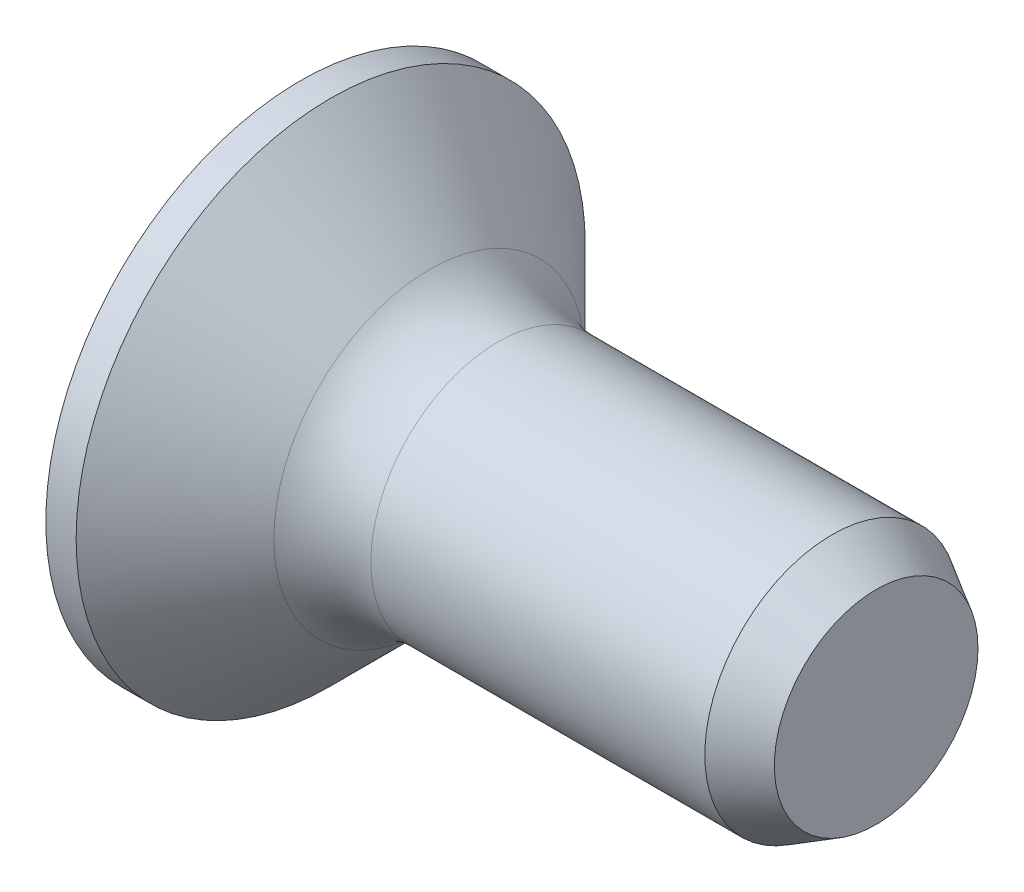
from build123d import *

# Parameters (mm, degrees)
CHAMFER1_SIZE      = 0.42
CHAMFER1_SIZE2     = 0.727461339
CUT_EXTRUDE1_DEPTH = 2.1
DRAFT1_ANGLE       = 35
DRAFT2_ANGLE       = 8
FILLET1_R          = 1.6


with BuildPart() as part:
    # Sketch1 → Revolve1 (revolve)
    with BuildSketch(Plane.XY):
        Polygon((0, 4.2), (0.5, 4.2), (2.6, 2.1), (9.5, 2.1), (9.5, 0), (0, 0), align=None)
    revolve(axis=Axis((6.620684694, 0, 0), (-1, 0, 0)))

    # Chamfer1
    chamfer1_edges = [part.edges().sort_by_distance(p)[0] for p in [
        (9.5, -2.1, 0),
    ]]
    chamfer1_side = [part.faces().sort_by_distance(p)[0] for p in [
        (9.5, 0, 0),
    ]]
    chamfer(chamfer1_edges, length=CHAMFER1_SIZE, length2=CHAMFER1_SIZE2, reference=chamfer1_side[0])

    # Sketch4 → Cut-Extrude1 (cut)
    with BuildSketch(Plane.ZY):
        Polygon((-0.575, 2.3), (-0.575, 0.575), (-2.3, 0.575), (-2.3, -0.575), (-0.575, -0.575), (-0.575, -2.3), (0.575, -2.3), (0.575, -0.575), (2.3, -0.575), (2.3, 0.575), (0.575, 0.575), (0.575, 2.3), align=None)
    extrude(amount=-CUT_EXTRUDE1_DEPTH, mode=Mode.SUBTRACT)

    # Draft1
    draft1_faces = [part.faces().sort_by_distance(p)[0] for p in [
        (1.05, 0, 2.3),
        (1.05, 2.3, 0),
        (1.05, 0, -2.3),
        (1.05, -2.3, 0),
    ]]
    draft(draft1_faces, Plane(origin=(0, 0, 0), x_dir=(0, 0, -1), z_dir=(-1, 0, 0)), DRAFT1_ANGLE)

    # Draft2
    draft2_faces = [part.faces().sort_by_distance(p)[0] for p in [
        (0.790017248, -1.160911984, -0.575),
        (0.790017248, -0.575, -1.160911984),
        (0.790017248, -0.575, 1.160911984),
        (0.790017248, -1.160911984, 0.575),
        (0.790017248, 1.160911984, 0.575),
        (0.790017248, 0.575, 1.160911984),
        (0.790017248, 0.575, -1.160911984),
        (0.790017248, 1.160911984, -0.575),
    ]]
    draft(draft2_faces, Plane(origin=(0, 0, 0), x_dir=(0, 0, -1), z_dir=(-1, 0, 0)), DRAFT2_ANGLE)

    # Sketch6 for Cut-Loft1 → Cut-Loft1 section 0
    with BuildSketch(Plane.ZY.offset(-2.1)):
        with BuildLine():
            Line((-0.554714208, 0.279864247), (-0.554714208, -0.279864247))
            # circular arc as an exact rational Bezier (weights 1, cos(half-angle), 1)
            Bezier((-0.554714208, -0.279864247), (-0.279864247, -0.279864247), (-0.279864247, -0.554714208), weights=[1, 0.707106781, 1])
            Line((-0.279864247, -0.554714208), (0.279864247, -0.554714208))
            Bezier((0.279864247, -0.554714208), (0.279864247, -0.279864247), (0.554714208, -0.279864247), weights=[1, 0.707106781, 1])
            Line((0.554714208, -0.279864247), (0.554714208, 0.279864247))
            Bezier((0.554714208, 0.279864247), (0.279864247, 0.279864247), (0.279864247, 0.554714208), weights=[1, 0.707106781, 1])
            Line((0.279864247, 0.554714208), (-0.279864247, 0.554714208))
            Bezier((-0.279864247, 0.554714208), (-0.279864247, 0.279864247), (-0.554714208, 0.279864247), weights=[1, 0.707106781, 1])
        make_face()
    # Sketch7 for Cut-Loft1 → Cut-Loft1 section 1
    with BuildSketch(Plane.ZY):
        with BuildLine():
            Line((0.849849961, 0.575), (0.849849961, -0.575))
            Bezier((0.849849961, -0.575), (0.575, -0.575), (0.575, -0.849849961), weights=[1, 0.707106781, 1])
            Line((0.575, -0.849849961), (-0.575, -0.849849961))
            Bezier((-0.575, -0.849849961), (-0.575, -0.575), (-0.849849961, -0.575), weights=[1, 0.707106781, 1])
            Line((-0.849849961, -0.575), (-0.849849961, 0.575))
            Bezier((-0.849849961, 0.575), (-0.575, 0.575), (-0.575, 0.849849961), weights=[1, 0.707106781, 1])
            Line((-0.575, 0.849849961), (0.575, 0.849849961))
            Bezier((0.575, 0.849849961), (0.575, 0.575), (0.849849961, 0.575), weights=[1, 0.707106781, 1])
        make_face()
    loft(mode=Mode.SUBTRACT)

    # Fillet1
    fillet1_edges = [part.edges().sort_by_distance(p)[0] for p in [
        (2.6, -2.1, 0),
    ]]
    fillet(fillet1_edges, radius=FILLET1_R)


solid = part.part
